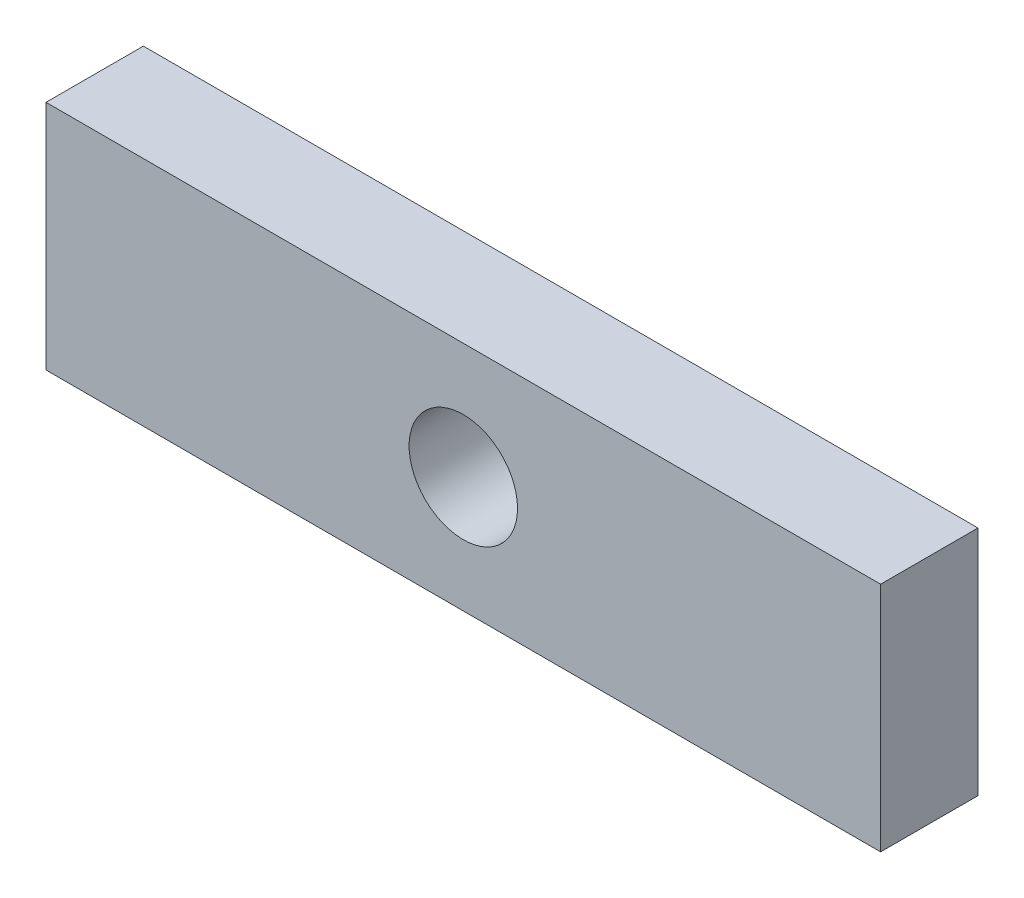
from build123d import *

# Parameters (mm, degrees)
SKETCH1_W           = 54
SKETCH1_H           = 15
BOSS_EXTRUDE1_DEPTH = 6.3
SKETCH2_R           = 3.508143049
CUT_EXTRUDE1_DEPTH  = 57.397606332


with BuildPart() as part:
    # Sketch1 → Boss-Extrude1 (new body)
    with BuildSketch(Plane.XY):
        with Locations((27, 7.5)):
            Rectangle(SKETCH1_W, SKETCH1_H)
    extrude(amount=BOSS_EXTRUDE1_DEPTH)

    # Sketch2 → Cut-Extrude1 (cut, through all)
    with BuildSketch(Plane.XY.offset(6.3)):
        with Locations((27, 7.5)):
            Circle(SKETCH2_R)
    extrude(amount=-CUT_EXTRUDE1_DEPTH, mode=Mode.SUBTRACT)


solid = part.part
